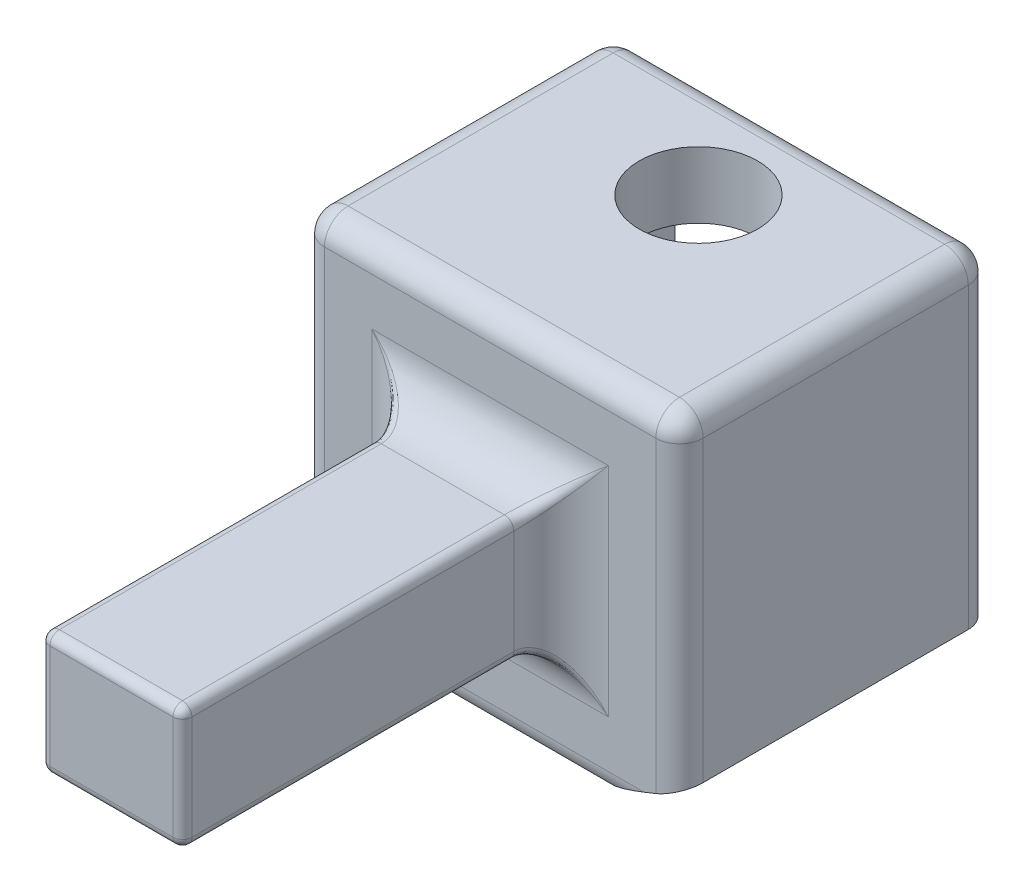
from build123d import *

# Parameters (mm, degrees)
SKETCH1_W               = 10.16
SKETCH1_H               = 9.652
BOSS_EXTRUDE1_DEPTH     = 7.112
CUT_EXTRUDE1_DEPTH      = 14.021061708
CUT_EXTRUDE1_DEPTH_BACK = 14.021061708
SKETCH2_R               = 1.5875
SKETCH7_W               = 10.16
SKETCH7_H               = 9.652
BOSS_EXTRUDE3_DEPTH     = 1.27
FILLET1_R               = 0.635
FILLET3_R               = 0.635
FILLET4_R               = 0.381
CUT_EXTRUDE3_DEPTH      = 14.574749537
CUT_EXTRUDE3_DEPTH_BACK = 14.574749537
FILLET9_R               = 0.254
CUT_EXTRUDE7_DEPTH      = 9.654656319
SKETCH14_W              = 3.81
SKETCH14_H              = 3.302
BOSS_EXTRUDE4_DEPTH     = 10.16
FILLET14_R              = 1.27
FILLET15_R              = 0.254


# Some blends are built 0.0001 mm under size
with BuildPart() as part:
    # Sketch1 → Boss-Extrude1 (new body)
    with BuildSketch(Plane.XY):
        Rectangle(SKETCH1_W, SKETCH1_H)
        Polygon((-4.445, -3.81), (4.445, -3.81), (4.445, -1.016), (3.429, -1.016), (3.429, 3.048), (-3.429, 3.048), (-3.429, -1.016), (-4.445, -1.016), align=None, mode=Mode.SUBTRACT)
    extrude(amount=BOSS_EXTRUDE1_DEPTH)

    # Sketch2 → Cut-Extrude1 (cut, two sides: drawn at the far end of the back side and taken through both)
    with BuildSketch(Plane(origin=(0, 4.826, 0), x_dir=(1, 0, 0), z_dir=(0, 1, 0)).offset(-CUT_EXTRUDE1_DEPTH_BACK)):
        with Locations(Location((0, -2.794, 0), (0, 0, 90))):
            Circle(SKETCH2_R)
    extrude(amount=CUT_EXTRUDE1_DEPTH + CUT_EXTRUDE1_DEPTH_BACK, mode=Mode.SUBTRACT)

    # Sketch7 → Boss-Extrude3 (add)
    with BuildSketch(Plane.XY.offset(7.112)):
        Rectangle(SKETCH7_W, SKETCH7_H)
    extrude(amount=BOSS_EXTRUDE3_DEPTH)

    # Fillet1
    fillet1_edges = [part.edges().sort_by_distance(p)[0] for p in [
        (-5.08, 0, 0),
        (0, 4.826, 0),
        (5.08, 0, 0),
    ]]
    fillet(fillet1_edges, radius=FILLET1_R - 0.0001)  # a hair under: the kernel refuses the full size

    # Fillet3
    # the kernel refuses this fillet: 0.635 mm, written as the material it takes off along each edge
    with BuildSketch(Plane(origin=(4.445, 4.191, 0), x_dir=(0, 1, 0), z_dir=(-1, 0, 0))) as fillet3_piece_1:
        with BuildLine():
            CenterArc((0.0001, -0.6349), 0.6349, 0, 90)
            Line((0.635, -0.6349), (0.635, 0))
            Line((0.635, 0), (0.0001, 0))
        make_face()
    revolve(axis=Axis((4.445, 4.191, 0), (0, 0, -1)), revolution_arc=90, mode=Mode.SUBTRACT)
    with BuildSketch(Plane(origin=(-4.445, 4.191, 0), x_dir=(-1, 0, 0), z_dir=(0, -1, 0))) as fillet3_piece_2:
        with BuildLine():
            CenterArc((0.0001, -0.6349), 0.6349, 0, 90)
            Line((0.635, -0.6349), (0.635, 0))
            Line((0.635, 0), (0.0001, 0))
        make_face()
    revolve(axis=Axis((-4.445, 4.191, 0), (0, 0, -1)), revolution_arc=90, mode=Mode.SUBTRACT)
    with BuildSketch(Plane(origin=(-4.445, -4.191, 7.747), x_dir=(0, 0, 1), z_dir=(-1, 0, 0))) as fillet3_piece_3_section:
        Polygon((0, 0), (FILLET3_R * 1.02, 0), (FILLET3_R * 1.02, -FILLET3_R * 1.02), (0, -FILLET3_R * 1.02), align=None)
    fillet3_piece_3 = extrude(amount=FILLET3_R * 1.02, mode=Mode.PRIVATE)
    fillet3_piece_3 = fillet3_piece_3 - Plane(origin=(-4.445, -4.191, 7.747), x_dir=(0, 0.7071067811865475, -0.7071067811865475), z_dir=(-1, 0, 0)) * Sphere(FILLET3_R, mode=Mode.PRIVATE)
    add(fillet3_piece_3, mode=Mode.SUBTRACT)
    with BuildSketch(Plane(origin=(-4.445, 4.191, 7.747), x_dir=(-1, 0, 0), z_dir=(0, 1, 0))) as fillet3_piece_4_section:
        Polygon((0, 0), (FILLET3_R * 1.02, 0), (FILLET3_R * 1.02, FILLET3_R * 1.02), (0, FILLET3_R * 1.02), align=None)
    fillet3_piece_4 = extrude(amount=FILLET3_R * 1.02, mode=Mode.PRIVATE)
    fillet3_piece_4 = fillet3_piece_4 - Plane(origin=(-4.445, 4.191, 7.747), x_dir=(0.7071067811865475, 0, -0.7071067811865475), z_dir=(0, 1, 0)) * Sphere(FILLET3_R, mode=Mode.PRIVATE)
    add(fillet3_piece_4, mode=Mode.SUBTRACT)
    with BuildSketch(Plane(origin=(4.445, -4.191, 7.747), x_dir=(1, 0, 0), z_dir=(0, 0, 1))) as fillet3_piece_5_section:
        Polygon((0, 0), (FILLET3_R * 1.02, 0), (FILLET3_R * 1.02, -FILLET3_R * 1.02), (0, -FILLET3_R * 1.02), align=None)
    fillet3_piece_5 = extrude(amount=FILLET3_R * 1.02, mode=Mode.PRIVATE)
    fillet3_piece_5 = fillet3_piece_5 - Plane(origin=(4.445, -4.191, 7.747), x_dir=(-0.7071067811865476, 0.7071067811865475, 0), z_dir=(0, 0, 1)) * Sphere(FILLET3_R, mode=Mode.PRIVATE)
    add(fillet3_piece_5, mode=Mode.SUBTRACT)
    with BuildSketch(Plane(origin=(4.445, 4.191, 7.747), x_dir=(0, 0, 1), z_dir=(0, 1, 0))) as fillet3_piece_6_section:
        Polygon((0, 0), (FILLET3_R * 1.02, 0), (FILLET3_R * 1.02, FILLET3_R * 1.02), (0, FILLET3_R * 1.02), align=None)
    fillet3_piece_6 = extrude(amount=FILLET3_R * 1.02, mode=Mode.PRIVATE)
    fillet3_piece_6 = fillet3_piece_6 - Plane(origin=(4.445, 4.191, 7.747), x_dir=(-0.7071067811865475, 0, -0.7071067811865475), z_dir=(0, 1, 0)) * Sphere(FILLET3_R, mode=Mode.PRIVATE)
    add(fillet3_piece_6, mode=Mode.SUBTRACT)
    with BuildSketch(Plane(origin=(-5.08, -4.191, 8.382), x_dir=(0, 0, -1), z_dir=(0, 1, 0))) as fillet3_piece_7:
        with BuildLine():
            CenterArc((FILLET3_R, -FILLET3_R), FILLET3_R, 90, 90)
            Line((0, -FILLET3_R), (-FILLET3_R * 0.02, -FILLET3_R))
            Line((-FILLET3_R * 0.02, -FILLET3_R), (-FILLET3_R * 0.02, FILLET3_R * 0.02))
            Line((-FILLET3_R * 0.02, FILLET3_R * 0.02), (FILLET3_R, FILLET3_R * 0.02))
            Line((FILLET3_R, FILLET3_R * 0.02), (FILLET3_R, 0))
        make_face()
    extrude(amount=8.382, mode=Mode.SUBTRACT)
    with BuildSketch(Plane(origin=(4.445, -4.826, 8.382), x_dir=(0, 1, 0), z_dir=(-1, 0, 0))) as fillet3_piece_8:
        with BuildLine():
            CenterArc((FILLET3_R, FILLET3_R), FILLET3_R, 180, 90)
            Line((0, FILLET3_R), (-FILLET3_R * 0.02, FILLET3_R))
            Line((-FILLET3_R * 0.02, FILLET3_R), (-FILLET3_R * 0.02, -FILLET3_R * 0.02))
            Line((-FILLET3_R * 0.02, -FILLET3_R * 0.02), (FILLET3_R, -FILLET3_R * 0.02))
            Line((FILLET3_R, -FILLET3_R * 0.02), (FILLET3_R, 0))
        make_face()
    extrude(amount=8.89, mode=Mode.SUBTRACT)
    with BuildSketch(Plane(origin=(5.08, 4.191, 8.382), x_dir=(-1, 0, 0), z_dir=(0, -1, 0))) as fillet3_piece_9:
        with BuildLine():
            CenterArc((FILLET3_R, FILLET3_R), FILLET3_R, 180, 90)
            Line((0, FILLET3_R), (-FILLET3_R * 0.02, FILLET3_R))
            Line((-FILLET3_R * 0.02, FILLET3_R), (-FILLET3_R * 0.02, -FILLET3_R * 0.02))
            Line((-FILLET3_R * 0.02, -FILLET3_R * 0.02), (FILLET3_R, -FILLET3_R * 0.02))
            Line((FILLET3_R, -FILLET3_R * 0.02), (FILLET3_R, 0))
        make_face()
    extrude(amount=8.382, mode=Mode.SUBTRACT)
    with BuildSketch(Plane(origin=(-4.445, 4.826, 8.382), x_dir=(0, 0, -1), z_dir=(1, 0, 0))) as fillet3_piece_10:
        with BuildLine():
            CenterArc((FILLET3_R, -FILLET3_R), FILLET3_R, 90, 90)
            Line((0, -FILLET3_R), (-FILLET3_R * 0.02, -FILLET3_R))
            Line((-FILLET3_R * 0.02, -FILLET3_R), (-FILLET3_R * 0.02, FILLET3_R * 0.02))
            Line((-FILLET3_R * 0.02, FILLET3_R * 0.02), (FILLET3_R, FILLET3_R * 0.02))
            Line((FILLET3_R, FILLET3_R * 0.02), (FILLET3_R, 0))
        make_face()
    extrude(amount=8.89, mode=Mode.SUBTRACT)
    with BuildSketch(Plane(origin=(6.0326, -4.826, 0), x_dir=(0, 0, 1), z_dir=(-1, 0, 0))) as fillet3_piece_11:
        with BuildLine():
            CenterArc((FILLET3_R, FILLET3_R), FILLET3_R, 180, 90)
            Line((0, FILLET3_R), (-FILLET3_R * 0.02, FILLET3_R))
            Line((-FILLET3_R * 0.02, FILLET3_R), (-FILLET3_R * 0.02, -FILLET3_R * 0.02))
            Line((-FILLET3_R * 0.02, -FILLET3_R * 0.02), (FILLET3_R, -FILLET3_R * 0.02))
            Line((FILLET3_R, -FILLET3_R * 0.02), (FILLET3_R, 0))
        make_face()
    extrude(amount=12.0652, mode=Mode.SUBTRACT)
    with BuildSketch(Plane(origin=(4.4451, -4.826, 0.6349), x_dir=(0, 0, -1), z_dir=(-1, 0, 0))) as fillet3_piece_12:
        with BuildLine():
            CenterArc((-0.0001, -0.635), FILLET3_R, 0, 89.990977043)
            Line((0.6349, -0.635), (0.6476, -0.635))
            Line((0.6476, -0.635), (0.6476, 0.0127))
            Line((0.6476, 0.0127), (0, 0.0127))
            Line((0, 0.0127), (0, -8e-09))
        make_face()
    revolve(axis=Axis((4.4451, -4.826, 0.6349), (0, -1, 0)), revolution_arc=90, mode=Mode.SUBTRACT)
    with BuildSketch(Plane(origin=(-4.4451, -4.826, 0.6349), x_dir=(0, 0, -1), z_dir=(1, 0, 0))) as fillet3_piece_13:
        with BuildLine():
            CenterArc((-0.0001, 0.635), FILLET3_R, 270.009022957, 89.990977043)
            Line((0.6349, 0.635), (0.6476, 0.635))
            Line((0.6476, 0.635), (0.6476, -0.0127))
            Line((0.6476, -0.0127), (0, -0.0127))
            Line((0, -0.0127), (0, 8e-09))
        make_face()
    revolve(axis=Axis((-4.4451, -4.826, 0.6349), (0, 1, 0)), revolution_arc=90, mode=Mode.SUBTRACT)
    with BuildSketch(Plane(origin=(5.08, -4.826, 7.747), x_dir=(0, 1, 0), z_dir=(0, 0, -1)), Plane(origin=(-5.08, -4.826, -0.9526), x_dir=(0, 1, 0), z_dir=(0, 0, 1))) as fillet3_piece_14:
        with BuildLine():
            CenterArc((FILLET3_R, -FILLET3_R), FILLET3_R, 90, 90)
            Line((0, -FILLET3_R), (-FILLET3_R * 0.02, -FILLET3_R))
            Line((-FILLET3_R * 0.02, -FILLET3_R), (-FILLET3_R * 0.02, FILLET3_R * 0.02))
            Line((-FILLET3_R * 0.02, FILLET3_R * 0.02), (FILLET3_R, FILLET3_R * 0.02))
            Line((FILLET3_R, FILLET3_R * 0.02), (FILLET3_R, 0))
        make_face()
    extrude(amount=8.6996, mode=Mode.SUBTRACT)
    with BuildSketch(Plane(origin=(-5.08, 4.826, 0), x_dir=(1, 0, 0), z_dir=(0, 0, 1)), Plane(origin=(5.08, 4.826, 7.747), x_dir=(-1, 0, 0), z_dir=(0, 0, -1))) as fillet3_piece_15:
        with BuildLine():
            CenterArc((FILLET3_R, -FILLET3_R), FILLET3_R, 90, 90)
            Line((0, -FILLET3_R), (-FILLET3_R * 0.02, -FILLET3_R))
            Line((-FILLET3_R * 0.02, -FILLET3_R), (-FILLET3_R * 0.02, FILLET3_R * 0.02))
            Line((-FILLET3_R * 0.02, FILLET3_R * 0.02), (FILLET3_R, FILLET3_R * 0.02))
            Line((FILLET3_R, FILLET3_R * 0.02), (FILLET3_R, 0))
        make_face()
    extrude(amount=7.747, mode=Mode.SUBTRACT)

    # Fillet4
    fillet4_edges = [part.edges().sort_by_distance(p)[0] for p in [
        (3.429, -1.016, 3.556),
        (-3.429, -1.016, 3.556),
    ]]
    fillet(fillet4_edges, radius=FILLET4_R)

    # Sketch11 → Cut-Extrude3 (cut, two sides: drawn at the far end of the back side and taken through both)
    with BuildSketch(Plane.ZY.offset(-4.445).offset(-CUT_EXTRUDE3_DEPTH_BACK)):
        Polygon((0, -3.81), (5.08, -3.81), (5.08, -4.064), (10.16, -4.826), (0, -4.826), align=None)
    extrude(amount=CUT_EXTRUDE3_DEPTH + CUT_EXTRUDE3_DEPTH_BACK, mode=Mode.SUBTRACT)

    # Fillet9
    fillet9_edges = [part.edges().sort_by_distance(p)[0] for p in [
        (-4.445, -3.81, 6.096),
        (4.445, -3.81, 6.096),
        (0, -3.81, 7.112),
    ]]
    fillet(fillet9_edges, radius=FILLET9_R)

    # Sketch13 → Cut-Extrude7 (cut, through all)
    with BuildSketch(Plane(origin=(0, 0, 5.08), x_dir=(-1, 0, 0), z_dir=(0, 0, -1))):
        Polygon((-5.08, -3.81), (-5.08, -4.826), (-2.54, -4.826), align=None)
        Polygon((5.08, -3.81), (5.08, -4.826), (2.032, -4.826), align=None)
    extrude(amount=-CUT_EXTRUDE7_DEPTH, mode=Mode.SUBTRACT)

    # Sketch14 → Boss-Extrude4 (add)
    with BuildSketch(Plane.XY.offset(8.382)):
        Rectangle(SKETCH14_W, SKETCH14_H)
    extrude(amount=BOSS_EXTRUDE4_DEPTH)

    # Fillet14
    fillet14_edges = [part.edges().sort_by_distance(p)[0] for p in [
        (0, 1.651, 8.382),
        (-1.905, 0, 8.382),
        (0, -1.651, 8.382),
        (1.905, 0, 8.382),
    ]]
    fillet(fillet14_edges, radius=FILLET14_R)

    # Fillet15
    fillet15_edges = [part.edges().sort_by_distance(p)[0] for p in [
        (1.905, 1.651, 14.097),
        (-1.905, 1.651, 14.097),
        (-1.905, -1.651, 14.097),
        (1.905, -1.651, 14.097),
        (0, 1.651, 18.542),
        (-1.905, 0, 18.542),
        (0, -1.651, 18.542),
        (1.905, 0, 18.542),
        (2.354517888, 2.100517888, 8.682614059),
        (2.354517888, -2.100517888, 8.682614059),
        (-2.354517888, 2.100517888, 8.682614059),
        (-2.354517888, -2.100517888, 8.682614059),
    ]]
    fillet(fillet15_edges, radius=FILLET15_R)


solid = part.part
